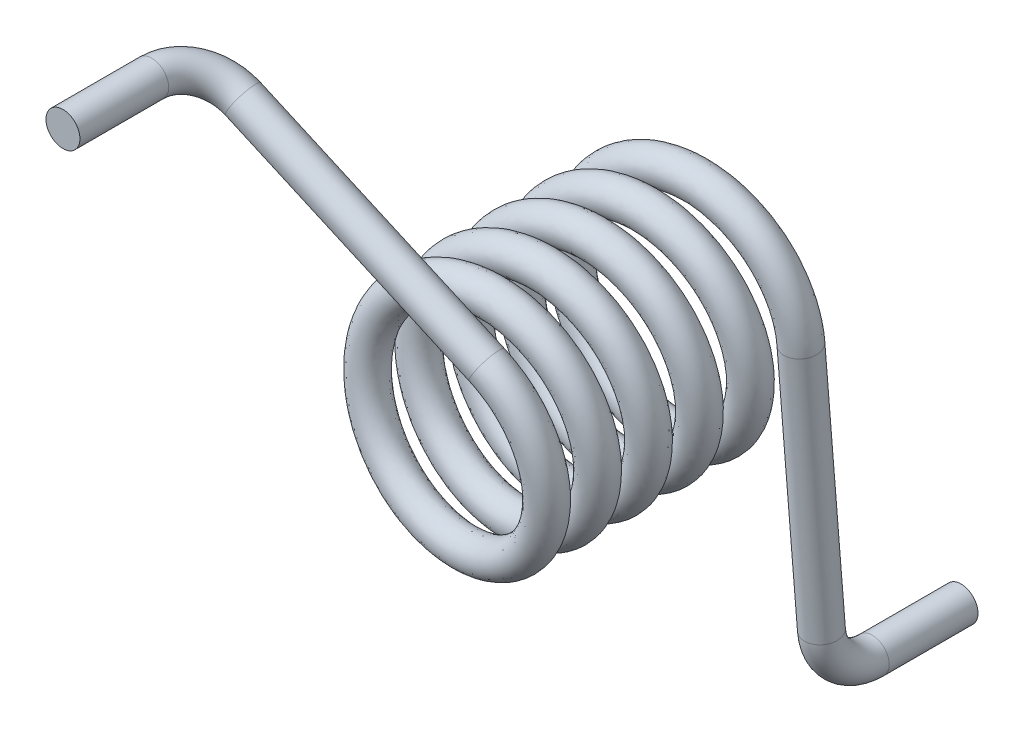
from build123d import *

# Parameters (mm, degrees)
SWEEP_2_PITCH     = 3
SWEEP_2_HEIGHT    = 15.5
SWEEP_2_RADIUS    = 6
SWEEP_2_PROFILE_R = 1
SWEEP_4_PROFILE_R = 1
SWEEP_5_PROFILE_R = 1


with BuildPart() as part:
    # 扫描2: sweep along a helix
    with BuildLine() as sweep_2_path:
        Helix(SWEEP_2_PITCH, SWEEP_2_HEIGHT, SWEEP_2_RADIUS, center=(0, 0, 0), direction=(0, 0, 1))
    # 扫描2 profile (on start of the path) → 扫描2 (sweep)
    with BuildSketch(Plane(origin=(6, 0, 0), x_dir=(0, -0.07932669684362768, 0.9968486721503316), z_dir=(-3.5130232848161826e-14, 0.9968486721503316, 0.07932669684362768))):
        Circle(SWEEP_2_PROFILE_R)
    sweep(path=sweep_2_path.line, is_frenet=True)


with BuildPart() as sweep_4_tool:
    # 扫描4: sweep along a path in 草图54
    with BuildLine(Plane(origin=(3.000051174, 5.196122877, 0), x_dir=(-0.863291365036805, 0.49843283822473433, 0.07932669684365871), z_dir=(0.5000085290273312, 0.8660204794922143, 0))) as sweep_4_path:
        Line((19.864235636, 23.425939108), (19.449416622, 18.21316964))
        ThreePointArc((19.449416622, 18.21316964), (18.494314012, 16.247296257), (16.458870605, 15.451149731))
        Line((16.458870605, 15.451149731), (1.229622061, 15.451149731))
    # 扫描4 profile (on start of the path) → 扫描4 (sweep)
    with BuildSketch(Plane(origin=(-12.539244014, 14.167943189, 24.927880492), x_dir=(-1, 0, 0), z_dir=(0, 0, -1))):
        Circle(SWEEP_4_PROFILE_R)
    sweep(path=sweep_4_path.line)


with BuildPart() as part_1:
    add(part.part)


with BuildPart() as part_2:
    # 扫描4: joined with sweep_4_tool
    add(part_1.part.fuse(sweep_4_tool.part, tol=0.00001))

    # 扫描5: sweep along a path in 草图97
    with BuildLine(Plane(origin=(6, 0, 0), x_dir=(0, -0.9968486721503291, -0.07932669684365838), z_dir=(-1, 0, 0))) as sweep_5_path:
        Line((0, 0), (15.229248544, 0))
        ThreePointArc((15.229248544, 0), (17.264691952, -0.796146526), (18.219794561, -2.762019909))
        Line((18.219794561, -2.762019909), (18.634613575, -7.974789377))
    # 扫描5 profile (on start of the path) → 扫描5 (sweep)
    with BuildSketch(Plane(origin=(6, 0, 0), x_dir=(0, 0.07932669684365833, -0.9968486721503291), z_dir=(0, -0.9968486721503291, -0.07932669684365833))):
        Circle(SWEEP_5_PROFILE_R)
    sweep(path=sweep_5_path.line)


solid = part_2.part
